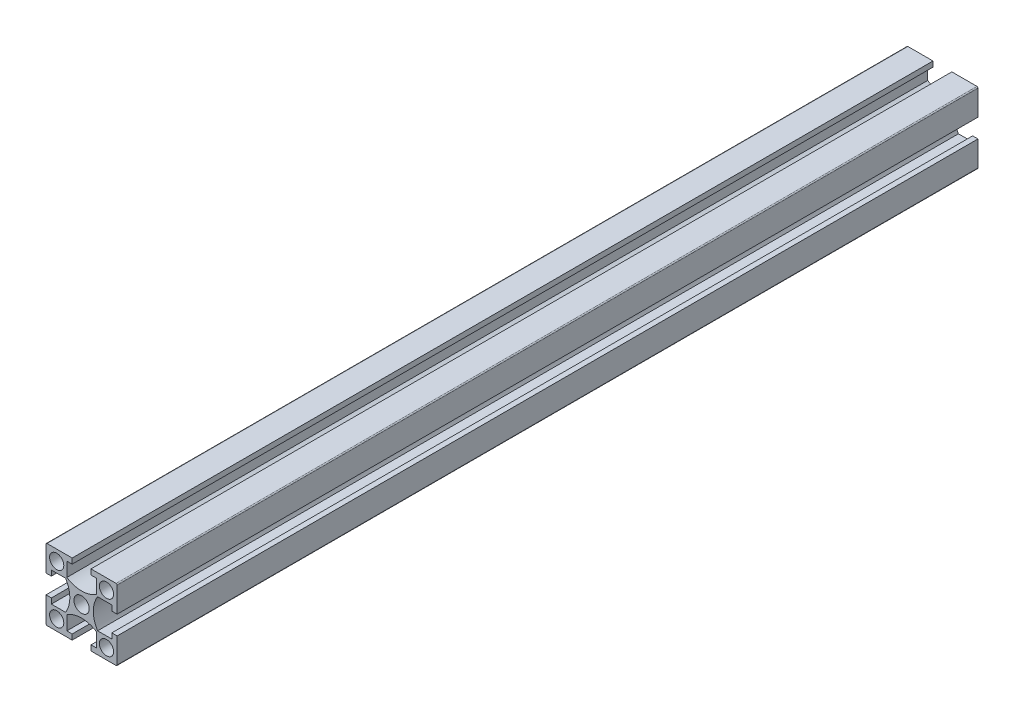
from build123d import *

# Parameters (mm, degrees)
SKETCH_1_W               = 20
SKETCH_1_H               = 20
SKETCH_1_R               = 2
SKETCH_1_R_2             = 2.15
EXTRUDE_1_DEPTH          = 242
CUT_EXTRUDE_1_REACH      = 244.413
PATTERN_CIRCULAR_1_COUNT = 4
FILLET_1_R               = 0.3
SKETCH_2_R               = 2.5
CUT_EXTRUDE_2_DEPTH      = 244.030862238


with BuildPart() as part:
    # 스케치1 → 보스-돌출1 (new body)
    with BuildSketch(Plane.XY):
        Rectangle(SKETCH_1_W, SKETCH_1_H)
        with Locations((-7, -7)):
            Circle(SKETCH_1_R, mode=Mode.SUBTRACT)
        with Locations((7, -7)):
            Circle(SKETCH_1_R, mode=Mode.SUBTRACT)
        with Locations((-7, 7)):
            Circle(SKETCH_1_R, mode=Mode.SUBTRACT)
        Circle(SKETCH_1_R_2, mode=Mode.SUBTRACT)
        with Locations((7, 7)):
            Circle(SKETCH_1_R, mode=Mode.SUBTRACT)
    extrude(amount=EXTRUDE_1_DEPTH)

    # 스케치1<3> → 컷-돌출1 (cut, up to next)
    with BuildSketch(Plane.XY, mode=Mode.PRIVATE) as cut_extrude_1_sk1:
        with BuildLine():
            Line((-8.5, 2.65), (-10, 2.65))
            Line((-10, 2.65), (-10, -2.65))
            Line((-10, -2.65), (-8.5, -2.65))
            Line((-8.5, -2.65), (-8.5, -4.15))
            Line((-8.5, -4.15), (-4.503166667, -4.15))
            ThreePointArc((-4.503166667, -4.15), (-3.3, 0), (-4.503166667, 4.15))
            Line((-4.503166667, 4.15), (-8.5, 4.15))
            Line((-8.5, 4.15), (-8.5, 2.65))
        make_face()
    cut_extrude_1_tool1 = extrude(cut_extrude_1_sk1.sketch, amount=CUT_EXTRUDE_1_REACH, mode=Mode.PRIVATE) & part.part
    cut_extrude_1 = cut_extrude_1_tool1.solids().sort_by_distance((-6.606913, 0, 0))[0]
    add(cut_extrude_1, mode=Mode.SUBTRACT)

    # 원형 패턴1: 컷-돌출1 ×4 about axis
    pattern_circular_1_axis = Axis((0, 0, 242), (0, 0, -1))
    for i in range(1, PATTERN_CIRCULAR_1_COUNT):
        add(cut_extrude_1.rotate(pattern_circular_1_axis, i * 360 / PATTERN_CIRCULAR_1_COUNT), mode=Mode.SUBTRACT)

    # 필렛1
    fillet_1_edges = [part.edges().sort_by_distance(p)[0] for p in [
        (10, -10, 121),
        (-10, -10, 121),
        (-10, 10, 121),
        (10, 10, 121),
    ]]
    fillet(fillet_1_edges, radius=FILLET_1_R)

    # 스케치2 → 컷-돌출2 (cut, through all)
    with BuildSketch(Plane(origin=(0, 10, 0), x_dir=(1, 0, 0), z_dir=(0, 1, 0))):
        with Locations((0, -231)):
            Circle(SKETCH_2_R)
        with Locations((0, -31)):
            Circle(SKETCH_2_R)
    extrude(amount=-CUT_EXTRUDE_2_DEPTH, mode=Mode.SUBTRACT)


solid = part.part
